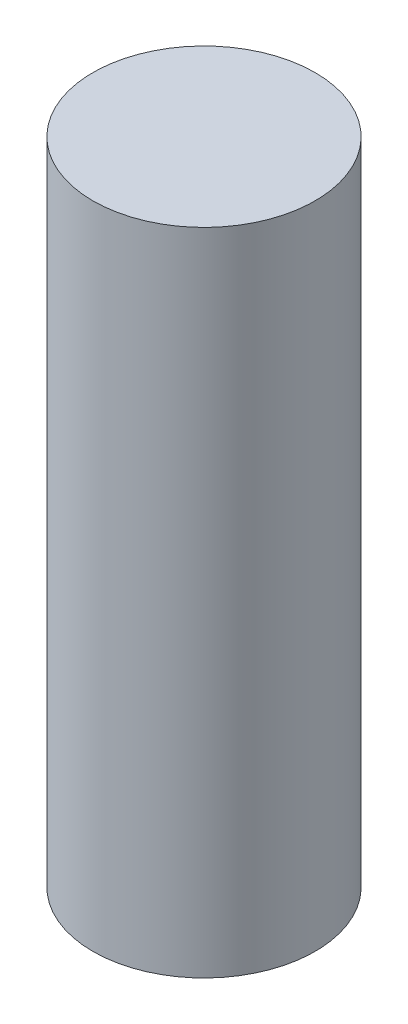
from build123d import *

# Parameters (mm, degrees)
SKETCH1_R           = 2
BOSS_EXTRUDE1_DEPTH = 11.7


with BuildPart() as part:
    # Sketch1 → Boss-Extrude1 (new body)
    with BuildSketch(Plane(origin=(0, 0, 0), x_dir=(1, 0, 0), z_dir=(0, 1, 0))):
        Circle(SKETCH1_R)
    extrude(amount=BOSS_EXTRUDE1_DEPTH)


solid = part.part
